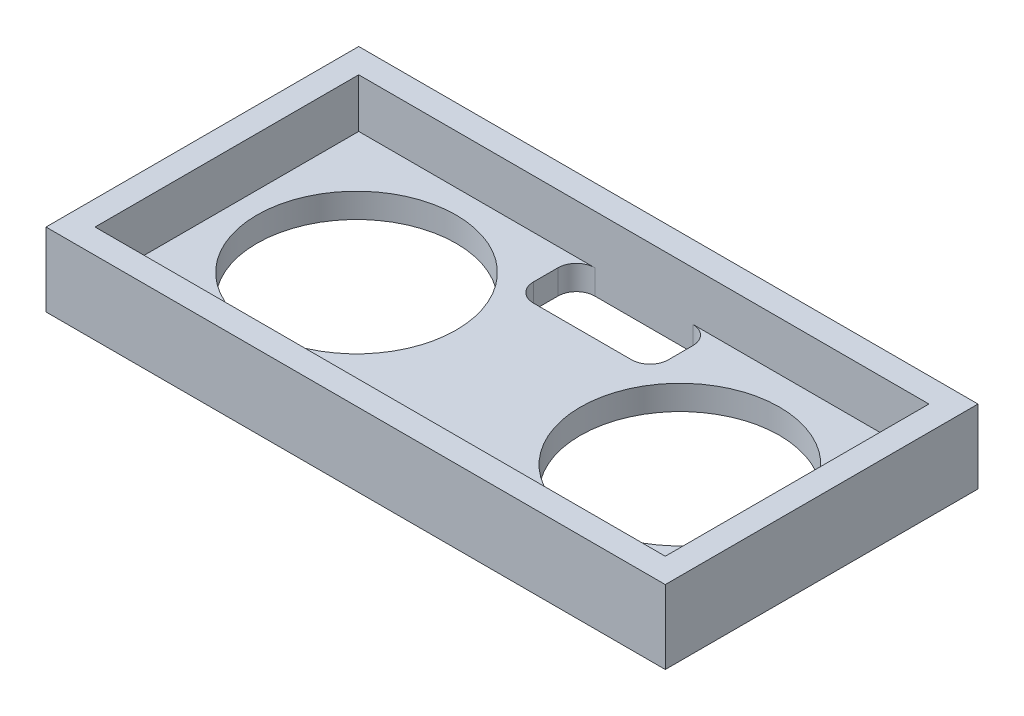
from build123d import *

# Parameters (mm, degrees)
SKETCH1_W               = 50.5
SKETCH1_H               = 25.5
BOSS_EXTRUDE1_DEPTH     = 2
MOVE_FACE1_BY           = 5
CUT_EXTRUDE1_DEPTH      = 12
CUT_EXTRUDE1_DEPTH_BACK = 0.0001
SKETCH2_W               = 46.5
SKETCH2_H               = 21.5
SKETCH3_R               = 8.125
CUT_EXTRUDE2_DEPTH      = 10.0001
SKETCH4_W               = 11
SKETCH4_H               = 5
CUT_EXTRUDE3_DEPTH      = 10.0001
FILLET1_R               = 1.5
SKETCH5_W               = 10
SKETCH5_H               = 2
CUT_EXTRUDE4_DEPTH      = 10.0001
FILLET2_R               = 1
MOVE_START              = 6
MOVE_FACE2_OUTLINE_W    = 50.5
MOVE_FACE2_OUTLINE_H    = 25.5
MOVE_FACE2_OUTLINE_W_2  = 46.5
MOVE_FACE2_OUTLINE_H_2  = 21.5
MOVE_FACE2_DEPTH        = 1


# Read off the part's stored shape, not the designer's step: Move Face2
with BuildPart() as part:
    # Sketch1 → Boss-Extrude1 (new body)
    with BuildSketch(Plane(origin=(0, 0, 0), x_dir=(1, 0, 0), z_dir=(0, 1, 0))):
        with Locations((-6.98861547, 1.365023474)):
            Rectangle(SKETCH1_W, SKETCH1_H)
    extrude(amount=BOSS_EXTRUDE1_DEPTH)

    # Move Face1: a face moved outward by 5.0
    extrude(part.faces().sort_by_distance((-6.98861547, 2, -1.365023474))[0], amount=MOVE_FACE1_BY, dir=(0, 1, 0))

    # Sketch2 → Cut-Extrude1 (cut, two sides: drawn at the far end of the back side and taken through both)
    with BuildSketch(Plane(origin=(0, 2, 0), x_dir=(1, 0, 0), z_dir=(0, 1, 0)).offset(-CUT_EXTRUDE1_DEPTH_BACK)):
        with Locations((-6.98861547, 1.365023474)):
            Rectangle(SKETCH2_W, SKETCH2_H)
    extrude(amount=CUT_EXTRUDE1_DEPTH + CUT_EXTRUDE1_DEPTH_BACK, mode=Mode.SUBTRACT)

    # Sketch3 → Cut-Extrude2 (cut)
    with BuildSketch(Plane(origin=(0, 1.9999, 0), x_dir=(1, 0, 0), z_dir=(0, 1, 0))):
        with Locations(Location((-20.36361547, 2.06192688, 0), (0, 0, 270))):
            Circle(SKETCH3_R)
        with Locations(Location((6.38638453, 1.683174436, 0), (0, 0, 270))):
            Circle(SKETCH3_R)
    extrude(amount=-CUT_EXTRUDE2_DEPTH, mode=Mode.SUBTRACT)

    # Sketch4 → Cut-Extrude3 (cut)
    with BuildSketch(Plane(origin=(0, 1.9999, 0), x_dir=(1, 0, 0), z_dir=(0, 1, 0))):
        with Locations((-6.98861547, 9.615023474)):
            Rectangle(SKETCH4_W, SKETCH4_H)
    extrude(amount=-CUT_EXTRUDE3_DEPTH, mode=Mode.SUBTRACT)

    # Fillet1
    fillet1_edges = [part.edges().sort_by_distance(p)[0] for p in [
        (-12.48861547, 0.99995, -7.115023474),
        (-12.48861547, 0.99995, -12.115023474),
        (-1.48861547, 0.99995, -12.115023474),
        (-1.48861547, 0.99995, -7.115023474),
    ]]
    fillet(fillet1_edges, radius=FILLET1_R)

    # Sketch5 → Cut-Extrude4 (cut)
    with BuildSketch(Plane(origin=(0, 1.9999, 0), x_dir=(1, 0, 0), z_dir=(0, 1, 0))):
        with Locations((-6.98861547, -8.384976526)):
            Rectangle(SKETCH5_W, SKETCH5_H)
    extrude(amount=-CUT_EXTRUDE4_DEPTH, mode=Mode.SUBTRACT)

    # Fillet2
    fillet2_edges = [part.edges().sort_by_distance(p)[0] for p in [
        (-1.98861547, 0.99995, 9.384976526),
        (-1.98861547, 0.99995, 7.384976526),
        (-11.98861547, 0.99995, 7.384976526),
        (-11.98861547, 0.99995, 9.384976526),
    ]]
    fillet(fillet2_edges, radius=FILLET2_R - 0.0001)  # a hair under: the kernel refuses the full size

    # Move Face2 outline → Move Face2 (cut)
    with BuildSketch(Plane(origin=(0, 0, 0), x_dir=(1, 0, 0), z_dir=(0, 1, 0)).offset(MOVE_START)):
        with Locations((-6.98861547, 1.365023474)):
            Rectangle(MOVE_FACE2_OUTLINE_W, MOVE_FACE2_OUTLINE_H)
        with Locations((-6.98861547, 1.365023474)):
            Rectangle(MOVE_FACE2_OUTLINE_W_2, MOVE_FACE2_OUTLINE_H_2, mode=Mode.SUBTRACT)
    extrude(amount=MOVE_FACE2_DEPTH, mode=Mode.SUBTRACT)


solid = part.part
